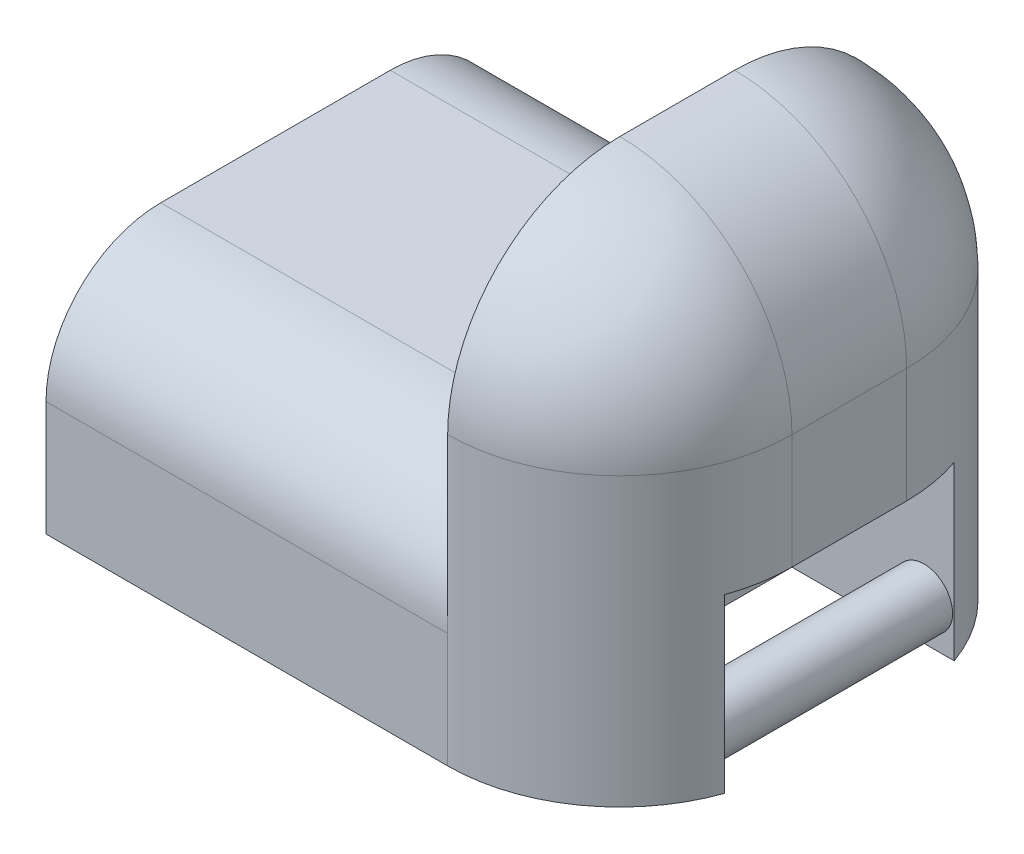
from build123d import *

# Parameters (mm, degrees)
SKETCH_1_W          = 100
SKETCH_1_H          = 40
EXTRUDE_1_DEPTH     = 80
SKETCH_3_W          = 30
SKETCH_3_H          = 30
CUT_EXTRUDE_2_DEPTH = 20
SKETCH_6_R          = 5
EXTRUDE_2_DEPTH     = 20
SKETCH_7_W          = 70
SKETCH_7_H          = 80
CUT_EXTRUDE_3_DEPTH = 40
FILLET_1_R          = 30
FILLET_2_R          = 30
FILLET_3_R          = 30
FILLET_4_R          = 20
FILLET_5_R          = 20


with BuildPart() as part:
    # 草圖1 → 填料-伸長1 (new body)
    with BuildSketch(Plane(origin=(0, 0, 0), x_dir=(1, 0, 0), z_dir=(0, 1, 0))):
        Rectangle(SKETCH_1_W, SKETCH_1_H)
    extrude_1 = extrude(amount=EXTRUDE_1_DEPTH)

    # 草圖3 → 除料-伸長2 (cut)
    with BuildSketch(Plane.XY.offset(20)):
        with Locations((-35, 15)):
            Rectangle(SKETCH_3_W, SKETCH_3_H)
        with Locations((35, 15)):
            Rectangle(SKETCH_3_W, SKETCH_3_H)
    cut_extrude_2 = extrude(amount=-CUT_EXTRUDE_2_DEPTH, mode=Mode.SUBTRACT)

    # 草圖6 → 填料-伸長2 (add)
    with BuildSketch(Plane.XY):
        with Locations((-43, 7)):
            Circle(SKETCH_6_R)
        with Locations((43, 7)):
            Circle(SKETCH_6_R)
    extrude_2 = extrude(amount=EXTRUDE_2_DEPTH)

    # 鏡射3: 填料-伸長1, 除料-伸長2, 填料-伸長2 across plane
    add(extrude_1.mirror(Plane(origin=(-50, 80, 20), x_dir=(1, 0, 0), z_dir=(0, 0, -1))))
    add(cut_extrude_2.mirror(Plane(origin=(-50, 80, 20), x_dir=(1, 0, 0), z_dir=(0, 0, -1))), mode=Mode.SUBTRACT)
    add(extrude_2.mirror(Plane(origin=(-50, 80, 20), x_dir=(1, 0, 0), z_dir=(0, 0, -1))))

    # 草圖7 → 除料-伸長3 (cut)
    with BuildSketch(Plane(origin=(0, 80, 0), x_dir=(1, 0, 0), z_dir=(0, 1, 0))):
        with Locations((-15, -20)):
            Rectangle(SKETCH_7_W, SKETCH_7_H)
    extrude(amount=-CUT_EXTRUDE_3_DEPTH, mode=Mode.SUBTRACT)

    # 圓角1
    fillet_1_edges = [part.edges().sort_by_distance(p)[0] for p in [
        (50, 80, 20),
    ]]
    fillet(fillet_1_edges, radius=FILLET_1_R - 0.0001)  # a hair under: the kernel refuses the full size

    # 圓角2
    fillet_2_edges = [part.edges().sort_by_distance(p)[0] for p in [
        (50, 25.00005, 60),
        (41.213232725, 71.213232725, 60),
    ]]
    fillet(fillet_2_edges, radius=FILLET_2_R - 0.0001)  # a hair under: the kernel refuses the full size

    # 圓角3
    fillet_3_edges = [part.edges().sort_by_distance(p)[0] for p in [
        (50, 25.00005, -20),
        (41.213232725, 71.213232725, -20),
    ]]
    fillet(fillet_3_edges, radius=FILLET_3_R - 0.0001)  # a hair under: the kernel refuses the full size

    # 圓角4
    fillet_4_edges = [part.edges().sort_by_distance(p)[0] for p in [
        (-15, 40, 60),
    ]]
    fillet(fillet_4_edges, radius=FILLET_4_R)

    # 圓角5
    fillet_5_edges = [part.edges().sort_by_distance(p)[0] for p in [
        (-15, 40, -20),
    ]]
    fillet(fillet_5_edges, radius=FILLET_5_R)


solid = part.part
